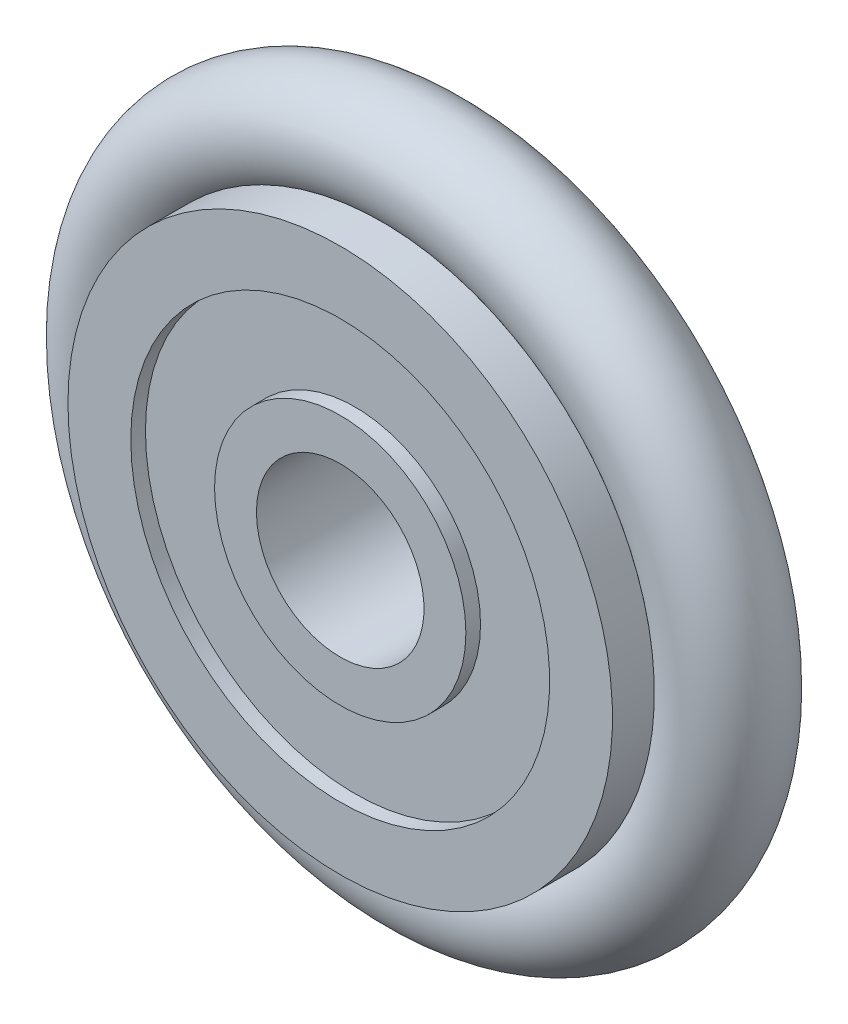
from build123d import *

# Parameters (mm, degrees)
SKETCH6_R = 1.25


with BuildPart() as part:
    # Sketch1 → Revolve1 (revolve)
    with BuildSketch(Plane(origin=(0, 0, 0), x_dir=(1, 0, 0), z_dir=(0, 1, 0))):
        with BuildLine():
            Line((2, 2), (2, -2))
            Line((2, -2), (3, -2))
            Line((3, -2), (3, -1.65))
            Line((3, -1.65), (5, -1.65))
            Line((5, -1.65), (5, -2))
            Line((5, -2), (6.5, -2))
            Line((6.5, -2), (6.5, -1))
            ThreePointArc((6.5, -1), (6, 0), (6.5, 1))
            Line((6.5, 1), (6.5, 2))
            Line((6.5, 2), (5, 2))
            Line((5, 2), (5, 1.65))
            Line((5, 1.65), (3, 1.65))
            Line((3, 1.65), (3, 2))
            Line((3, 2), (2, 2))
        make_face()
    revolve(axis=Axis((0, 0, -2), (0, 0, 1)))


with BuildPart() as body_2:
    # Sketch6 → O-Ring Revolve (revolve)
    with BuildSketch(Plane(origin=(0, 0, 0), x_dir=(1, 0, 0), z_dir=(0, 1, 0))):
        with Locations((7.25, 0)):
            Circle(SKETCH6_R)
    revolve(axis=Axis((0, 0, 0), (0, 0, -1)))


solid = Compound([part.part, body_2.part])
